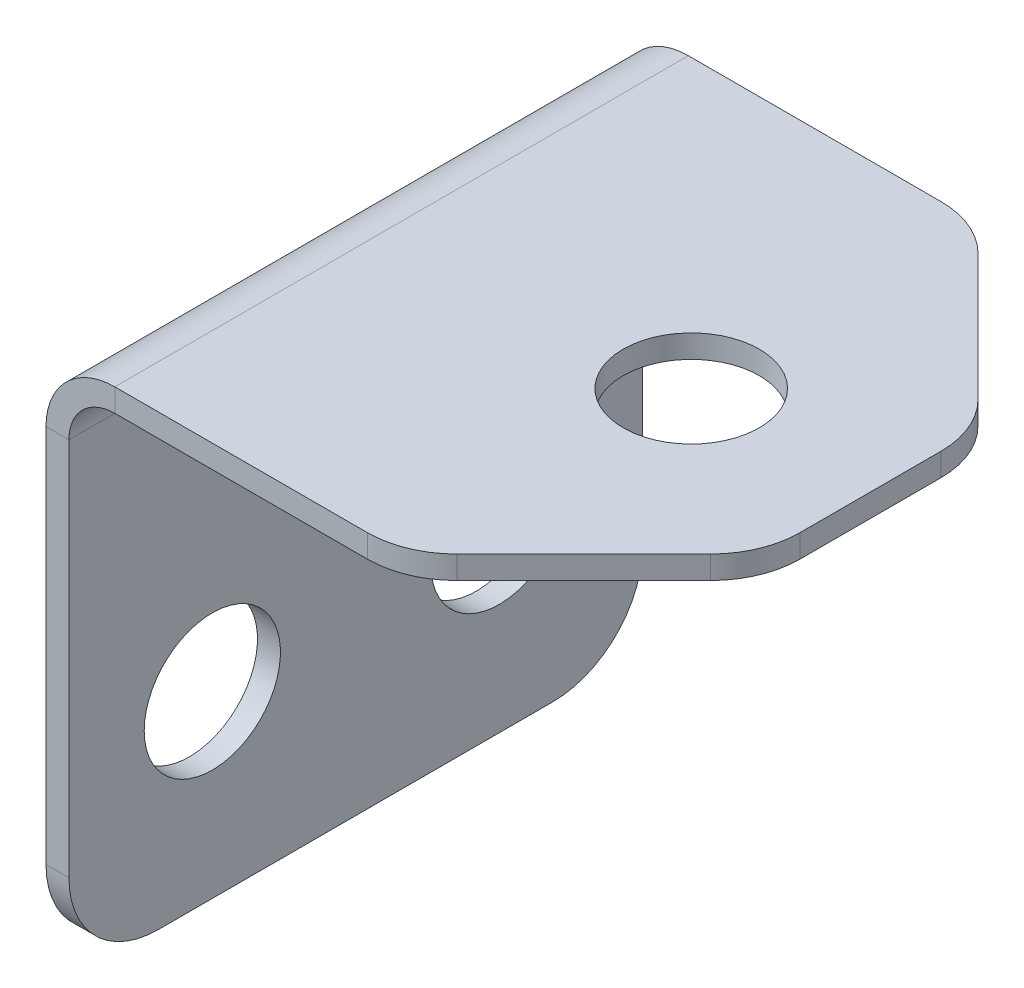
from build123d import *

# Parameters (mm, degrees)
SKETCH1_W                    = 16
SKETCH1_H                    = 15
BOSS_EXTRUDE1_DEPTH          = 0.64
EDGE_FLANGE1_STRIP_W         = 5.12
EDGE_FLANGE1_STRIP_H         = 0.64
EDGE_FLANGE1_STRIP_CUT_DEPTH = 16
EDGE_FLANGE1_DEPTH           = 16
SKETCH9_R                    = 1.9
CUT_EXTRUDE1_DEPTH           = 27.570660511
SKETCH10_R                   = 1.9
CUT_EXTRUDE2_DEPTH           = 27.570660511
CHAMFER1_SIZE                = 5
FILLET1_R                    = 2.5


# Sheet-metal steps are written as plain solids
with BuildPart() as part:
    # Sketch1 → Boss-Extrude1 (new body)
    with BuildSketch(Plane(origin=(0, 0, 0), x_dir=(0, 0, -1), z_dir=(1, 0, 0))):
        with Locations((8, 7.5)):
            Rectangle(SKETCH1_W, SKETCH1_H)
    extrude(amount=BOSS_EXTRUDE1_DEPTH)

    # Edge-Flange1 strip (across the edge) → Edge-Flange1 strip cut (cut)
    with BuildSketch(Plane(origin=(0.64, 15, -16), x_dir=(0, -1, 0), z_dir=(0, 0, 1))):
        with Locations((-0.64, -0.32)):
            Rectangle(EDGE_FLANGE1_STRIP_W, EDGE_FLANGE1_STRIP_H)
    extrude(amount=EDGE_FLANGE1_STRIP_CUT_DEPTH, mode=Mode.SUBTRACT)

    # Edge-Flange1 section (across the edge) → Edge-Flange1 (add)
    with BuildSketch(Plane(origin=(0.64, 15, -16), x_dir=(0, -1, 0), z_dir=(0, 0, 1))):
        with BuildLine():
            Line((0, 1.28), (0, 14.36))
            Line((0, 14.36), (0.64, 14.36))
            Line((0.64, 14.36), (0.64, 1.28))
            ThreePointArc((0.64, 1.28), (1.01490332, 0.37490332), (1.92, 0))
            Line((1.92, 0), (1.92, -0.64))
            ThreePointArc((1.92, -0.64), (0.56235498, -0.07764502), (0, 1.28))
        make_face()
    extrude(amount=EDGE_FLANGE1_DEPTH)

    # Sketch9 → Cut-Extrude1 (cut, through all)
    with BuildSketch(Plane.ZY):
        with Locations((-12, 5)):
            Circle(SKETCH9_R)
        with Locations((-4, 5)):
            Circle(SKETCH9_R)
    extrude(amount=-CUT_EXTRUDE1_DEPTH, mode=Mode.SUBTRACT)

    # Sketch10 → Cut-Extrude2 (cut, through all)
    with BuildSketch(Plane(origin=(0, 15, 0), x_dir=(1, 0, 0), z_dir=(0, 1, 0))):
        with Locations(Location((10, 8, 0), (0, 0, 180))):
            Circle(SKETCH10_R)
    extrude(amount=-CUT_EXTRUDE2_DEPTH, mode=Mode.SUBTRACT)

    # Chamfer1
    chamfer1_edges = [part.edges().sort_by_distance(p)[0] for p in [
        (15, 14.68, -16),
        (15, 14.68, 0),
    ]]
    chamfer(chamfer1_edges, length=CHAMFER1_SIZE)

    # Fillet1
    fillet1_edges = [part.edges().sort_by_distance(p)[0] for p in [
        (10, 14.68, -16),
        (15, 14.68, -5),
        (15, 14.68, -11),
        (10, 14.68, 0),
        (0.32, 0, 0),
        (0.32, 0, -16),
    ]]
    fillet(fillet1_edges, radius=FILLET1_R)


solid = part.part
